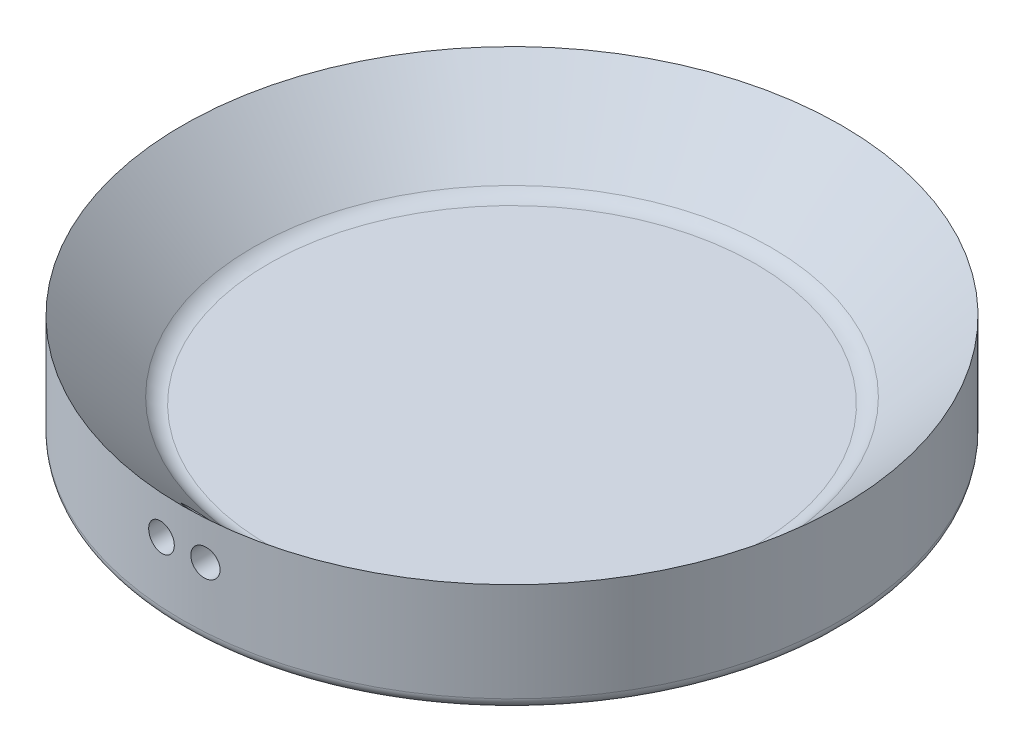
from build123d import *

# Parameters (mm, degrees)
CUT_EXTRUDE1_REACH = 69.823
SKETCH5_R          = 1.25


with BuildPart() as part:
    # Sketch3 → Revolve3 (revolve)
    with BuildSketch(Plane.XY):
        with BuildLine():
            Line((-23, 0), (0, 0))
            Line((0, 0), (0, 3))
            Line((0, 3), (-22.171572875, 3))
            ThreePointArc((-22.171572875, 3), (-22.93693974, 3.152240935), (-23.585786438, 3.585786438))
            Line((-23.585786438, 3.585786438), (-30, 10))
            Line((-30, 10), (-30, 1))
            ThreePointArc((-30, 1), (-29.707106781, 0.292893219), (-29, 0))
            Line((-29, 0), (-23, 0))
        make_face()
    revolve(axis=Axis((0, 0, 0), (0, 1, 0)))

    # Sketch5 → Cut-Extrude1 (cut, up to next)
    with BuildSketch(Plane.XY.offset(30), mode=Mode.PRIVATE) as cut_extrude1_sk1:
        with Locations((-2, 6.5)):
            Circle(SKETCH5_R)
    cut_extrude1_tool1 = extrude(cut_extrude1_sk1.sketch, amount=-CUT_EXTRUDE1_REACH, mode=Mode.PRIVATE) & part.part
    # Sketch5 → Cut-Extrude1 (cut, up to next)
    with BuildSketch(Plane.XY.offset(30), mode=Mode.PRIVATE) as cut_extrude1_sk2:
        with Locations((2, 6.5)):
            Circle(SKETCH5_R)
    cut_extrude1_tool2 = extrude(cut_extrude1_sk2.sketch, amount=-CUT_EXTRUDE1_REACH, mode=Mode.PRIVATE) & part.part
    add(cut_extrude1_tool1.solids().sort_by_distance((-2, 6.5, 30))[0], mode=Mode.SUBTRACT)
    add(cut_extrude1_tool2.solids().sort_by_distance((2, 6.5, 30))[0], mode=Mode.SUBTRACT)


solid = part.part
